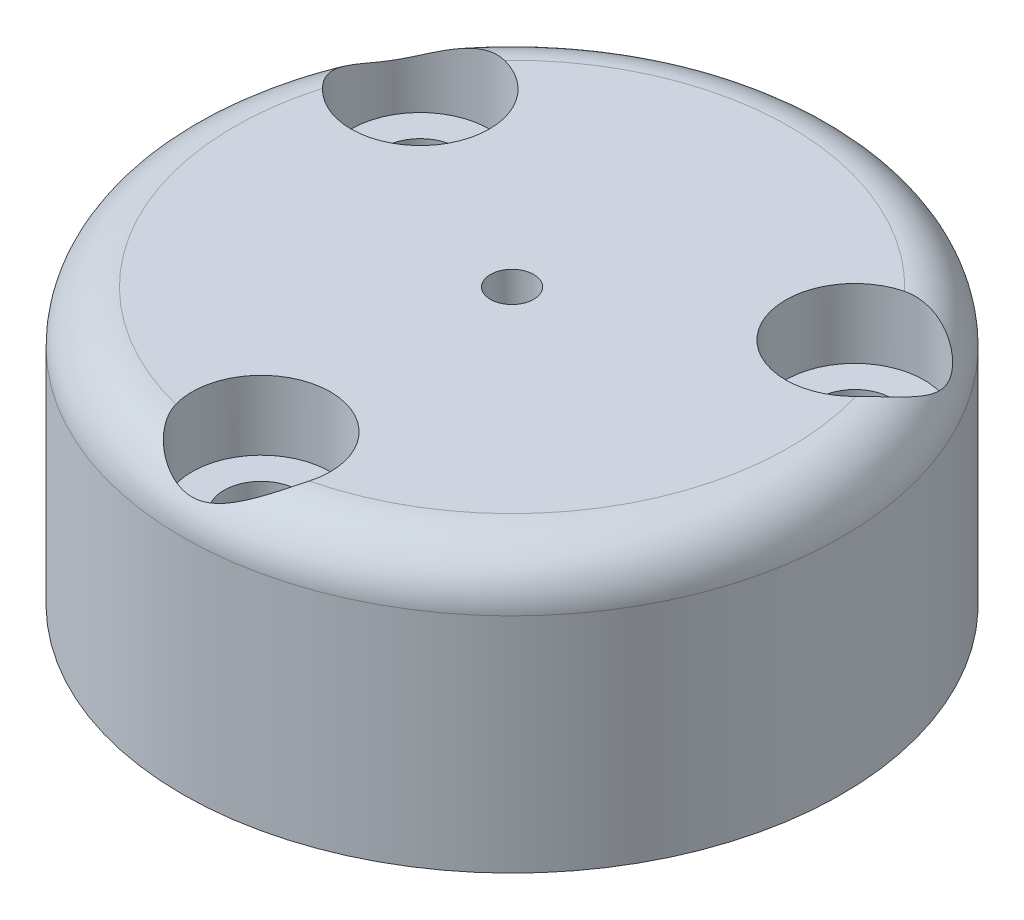
from build123d import *

# Parameters (mm, degrees)
SKETCH1_R                      = 19.05
BOSS_EXTRUDE1_DEPTH            = 15.875
SKETCH2_R                      = 7
CUT_EXTRUDE1_DEPTH             = 7
SKETCH3_R                      = 6
CUT_EXTRUDE2_DEPTH             = 7
M3X0_5_TAPPED_HOLE1_D          = 2.5
CBORE_FOR_M4_SHCS1_D           = 4.3
CBORE_FOR_M4_SHCS1_CBORE_D     = 8
CBORE_FOR_M4_SHCS1_CBORE_DEPTH = 4
CIRPATTERN1_COUNT              = 3
FILLET1_R                      = 3
CUT_EXTRUDE3_DEPTH             = 10
CIRPATTERN2_COUNT              = 3


with BuildPart() as part:
    # Sketch1 → Boss-Extrude1 (new body)
    with BuildSketch(Plane(origin=(0, 0, 0), x_dir=(1, 0, 0), z_dir=(0, 1, 0))):
        with Locations(Location((0, 0, 0), (0, 0, 270))):
            Circle(SKETCH1_R)
    extrude(amount=BOSS_EXTRUDE1_DEPTH)

    # Sketch2 → Cut-Extrude1 (cut)
    with BuildSketch(Plane.XZ):
        with Locations(Location((0, 0, 0), (0, 0, 270))):
            Circle(SKETCH2_R)
    extrude(amount=-CUT_EXTRUDE1_DEPTH, mode=Mode.SUBTRACT)

    # Sketch3 → Cut-Extrude2 (cut)
    with BuildSketch(Plane.XZ.offset(-7)):
        with Locations(Location((0, 0, 0), (0, 0, 270))):
            Circle(SKETCH3_R)
    extrude(amount=-CUT_EXTRUDE2_DEPTH, mode=Mode.SUBTRACT)

    # M3x0.5 Tapped Hole1 (through all)
    with Locations(Plane.XZ.offset(-14)):
        with Locations((0, 0)):
            Hole(M3X0_5_TAPPED_HOLE1_D / 2)

    # CBORE for M4 SHCS1 (through all)
    with Locations(Plane(origin=(0, 15.875, 0), x_dir=(-1, 0, 0), z_dir=(0, 1, 0))):
        with Locations((0, 14.5)):
            cbore_for_m4_shcs1 = CounterBoreHole(CBORE_FOR_M4_SHCS1_D / 2, CBORE_FOR_M4_SHCS1_CBORE_D / 2, CBORE_FOR_M4_SHCS1_CBORE_DEPTH)

    # CirPattern1: CBORE for M4 SHCS1 ×3 about axis
    cirpattern1_axis = Axis((0, 0, 0), (0, 1, 0))
    for i in range(1, CIRPATTERN1_COUNT):
        add(cbore_for_m4_shcs1.rotate(cirpattern1_axis, i * 360 / CIRPATTERN1_COUNT), mode=Mode.SUBTRACT)

    # Fillet1
    # the kernel refuses this fillet: 3 mm, written as the material it takes off along each edge
    with BuildSketch(Plane(origin=(0, 15.875, 0), x_dir=(0, 0, 1), z_dir=(-1, 0, 0))) as fillet1_piece_1:
        with BuildLine():
            CenterArc((19.05 - FILLET1_R, -FILLET1_R), FILLET1_R, 0, 90)
            Line((19.05 - FILLET1_R, 0), (19.05, 0))
            Line((19.05, 0), (19.05, -FILLET1_R))
        make_face()
    revolve(axis=Axis((0, 15.875, 0), (0, 1, 0)), mode=Mode.SUBTRACT)

    # Sketch9 → Cut-Extrude3 (cut)
    with BuildSketch(Plane.XZ):
        with BuildLine():
            ThreePointArc((-6, 10.392304845), (-5.084936491, 13.807368355), (-8.5, 14.722431864))
            ThreePointArc((-8.5, 14.722431864), (-14.722431864, 8.5), (-17, 0))
            ThreePointArc((-17, 0), (-14.5, -2.5), (-12, 0))
            ThreePointArc((-12, 0), (-10.392304845, 6), (-6, 10.392304845))
        make_face()
    cut_extrude3 = extrude(amount=-CUT_EXTRUDE3_DEPTH, mode=Mode.SUBTRACT)

    # CirPattern2: Cut-Extrude3 ×3 about axis
    cirpattern2_axis = Axis((0, 0, 0), (0, 1, 0))
    for i in range(1, CIRPATTERN2_COUNT):
        add(cut_extrude3.rotate(cirpattern2_axis, i * 360 / CIRPATTERN2_COUNT), mode=Mode.SUBTRACT)


solid = part.part
